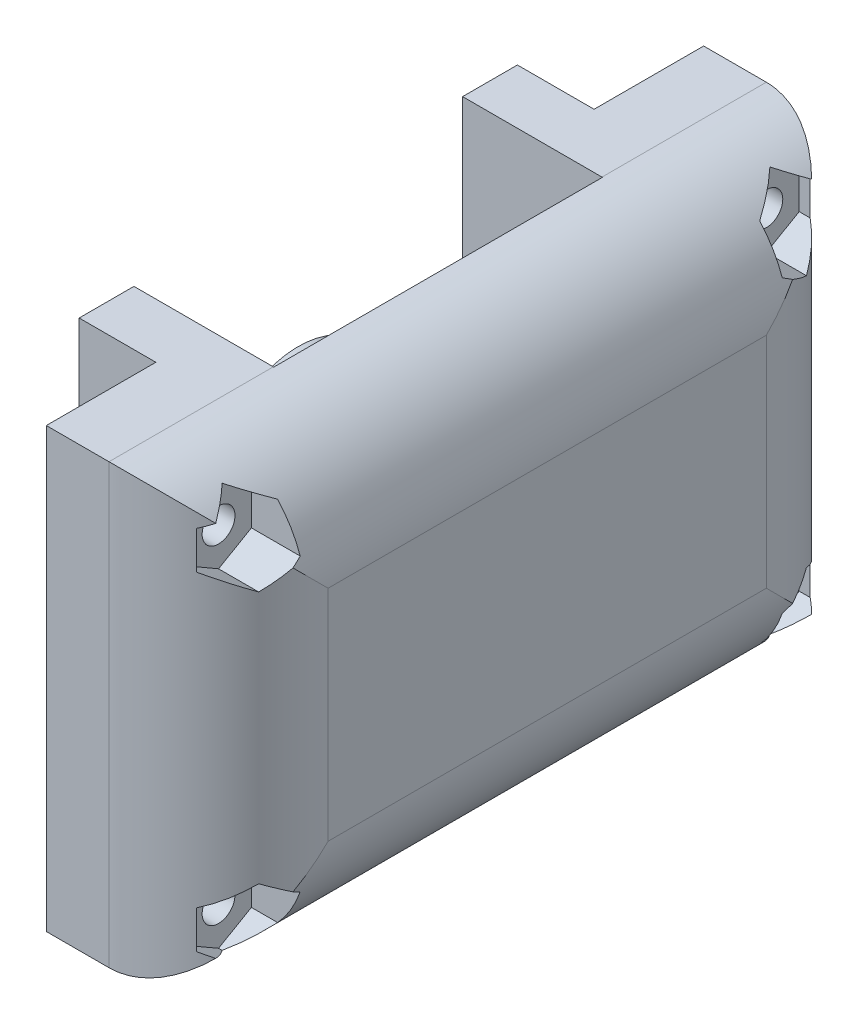
from build123d import *
from build123d.topology import SkipClean

# Parameters (mm, degrees)
CROQUIS1_W              = 60
CROQUIS1_H              = 40
CROQUIS1_R              = 1.5
SALIENTE_EXTRUIR1_DEPTH = 17.96
SALIENTE_EXTRUIR2_START = 4.7625
CROQUIS3_W              = 15
CROQUIS3_H              = 40
CROQUIS3_R              = 1.5
SALIENTE_EXTRUIR2_DEPTH = 4.7625
CROQUIS4_R              = 7.75
SALIENTE_EXTRUIR3_DEPTH = 4.7625
REDONDEO2_R             = 10
CORTAR_EXTRUIR1_DEPTH   = 5
CROQUIS6_W              = 10
CROQUIS6_H              = 40
CORTAR_EXTRUIR2_DEPTH   = 7
CORTAR_EXTRUIR3_START   = -8
CROQUIS7_W              = 30
CROQUIS7_H              = 40
CROQUIS7_R              = 7.75
CORTAR_EXTRUIR3_DEPTH   = 8


with BuildPart() as part:
    # Croquis1 → Saliente-Extruir1 (new body)
    with BuildSketch(Plane(origin=(0, 0, 0), x_dir=(0, 0, -1), z_dir=(1, 0, 0))):
        Rectangle(CROQUIS1_W, CROQUIS1_H)
        with Locations((-25, 15)):
            Circle(CROQUIS1_R, mode=Mode.SUBTRACT)
        with Locations(Location((25, 15, 0), (0, 0, 180))):
            Circle(CROQUIS1_R, mode=Mode.SUBTRACT)
        with Locations((25, -15)):
            Circle(CROQUIS1_R, mode=Mode.SUBTRACT)
        with Locations(Location((-25, -15, 0), (0, 0, 180))):
            Circle(CROQUIS1_R, mode=Mode.SUBTRACT)
    extrude(amount=SALIENTE_EXTRUIR1_DEPTH)

    # Croquis3 → Saliente-Extruir2 (add)
    # profile 1 of 2: a face of its own
    with SkipClean():  # the faces are left unmerged after this step: merging them gives an invalid solid
        with BuildSketch(Plane.ZY.offset(SALIENTE_EXTRUIR2_START)):
            with Locations((-22.5, 0)):
                Rectangle(CROQUIS3_W, CROQUIS3_H)
            with Locations((-25, -15)):
                Circle(CROQUIS3_R, mode=Mode.SUBTRACT)
            with Locations((-25, 15)):
                Circle(CROQUIS3_R, mode=Mode.SUBTRACT)
        # profile 2 of 2: a face of its own
        with BuildSketch(Plane.ZY.offset(SALIENTE_EXTRUIR2_START)):
            with Locations((22.5, 0)):
                Rectangle(CROQUIS3_W, CROQUIS3_H)
            with Locations((25, -15)):
                Circle(CROQUIS3_R, mode=Mode.SUBTRACT)
            with Locations((25, 15)):
                Circle(CROQUIS3_R, mode=Mode.SUBTRACT)
        extrude(amount=-SALIENTE_EXTRUIR2_DEPTH)

    # Croquis4 → Saliente-Extruir3 (add)
    with SkipClean():  # the faces are left unmerged after this step: merging them gives an invalid solid
        with BuildSketch(Plane.ZY):
            with Locations(Location((0, 0, 0), (0, 0, 180))):
                Circle(CROQUIS4_R)
        extrude(amount=SALIENTE_EXTRUIR3_DEPTH)

    # Redondeo2
    # the kernel refuses this fillet: 10 mm, written as the material it takes off along each edge
    with BuildSketch(Plane(origin=(17.96, -45, -30), x_dir=(-1, 0, 0), z_dir=(0, 1, 0)), Plane(origin=(17.96, 45, 30), x_dir=(-1, 0, 0), z_dir=(0, -1, 0))) as redondeo2_piece_1:
        with BuildLine():
            CenterArc((REDONDEO2_R, REDONDEO2_R), REDONDEO2_R, 180, 90)
            Line((0, REDONDEO2_R), (0, 0))
            Line((0, 0), (REDONDEO2_R, 0))
        make_face()
    extrude(amount=90, mode=Mode.SUBTRACT)
    with BuildSketch(Plane(origin=(17.96, 20, -55), x_dir=(0, -1, 0), z_dir=(0, 0, 1))) as redondeo2_piece_2:
        with BuildLine():
            CenterArc((REDONDEO2_R, -REDONDEO2_R), REDONDEO2_R, 90, 90)
            Line((0, -REDONDEO2_R), (0, 0))
            Line((0, 0), (REDONDEO2_R, 0))
        make_face()
    extrude(amount=110, mode=Mode.SUBTRACT)
    with BuildSketch(Plane(origin=(17.96, -20, 55), x_dir=(-1, 0, 0), z_dir=(0, 0, -1))) as redondeo2_piece_3:
        with BuildLine():
            CenterArc((REDONDEO2_R, REDONDEO2_R), REDONDEO2_R, 180, 90)
            Line((0, REDONDEO2_R), (0, 0))
            Line((0, 0), (REDONDEO2_R, 0))
        make_face()
    extrude(amount=110, mode=Mode.SUBTRACT)

    # Croquis5 → Cortar-Extruir1 (cut)
    with BuildSketch(Plane(origin=(17.96, 0, 0), x_dir=(0, 0, -1), z_dir=(1, 0, 0))):
        Polygon((-25, 18.464101615), (-28, 16.732050808), (-28, 13.267949192), (-25, 11.535898385), (-22, 13.267949192), (-22, 16.732050808), align=None)
        Polygon((25, 18.464101615), (22, 16.732050808), (22, 13.267949192), (25, 11.535898385), (28, 13.267949192), (28, 16.732050808), align=None)
        Polygon((25, -18.464101615), (28, -16.732050808), (28, -13.267949192), (25, -11.535898385), (22, -13.267949192), (22, -16.732050808), align=None)
        Polygon((-25, -18.464101615), (-22, -16.732050808), (-22, -13.267949192), (-25, -11.535898385), (-28, -13.267949192), (-28, -16.732050808), align=None)
    extrude(amount=-CORTAR_EXTRUIR1_DEPTH, mode=Mode.SUBTRACT)

    # Croquis6 → Cortar-Extruir2 (cut)
    with BuildSketch(Plane.ZY.offset(4.7625)):
        with Locations((25, 0)):
            Rectangle(CROQUIS6_W, CROQUIS6_H)
        with Locations((-25, 0)):
            Rectangle(CROQUIS6_W, CROQUIS6_H)
    extrude(amount=-CORTAR_EXTRUIR2_DEPTH, mode=Mode.SUBTRACT)

    # Croquis7 → Cortar-Extruir3 (cut)
    with BuildSketch(Plane.ZY.offset(CORTAR_EXTRUIR3_START)):
        Rectangle(CROQUIS7_W, CROQUIS7_H)
        with Locations(Location((0, 0, 0), (0, 0, 180))):
            Circle(CROQUIS7_R, mode=Mode.SUBTRACT)
    extrude(amount=CORTAR_EXTRUIR3_DEPTH, mode=Mode.SUBTRACT)


solid = part.part
